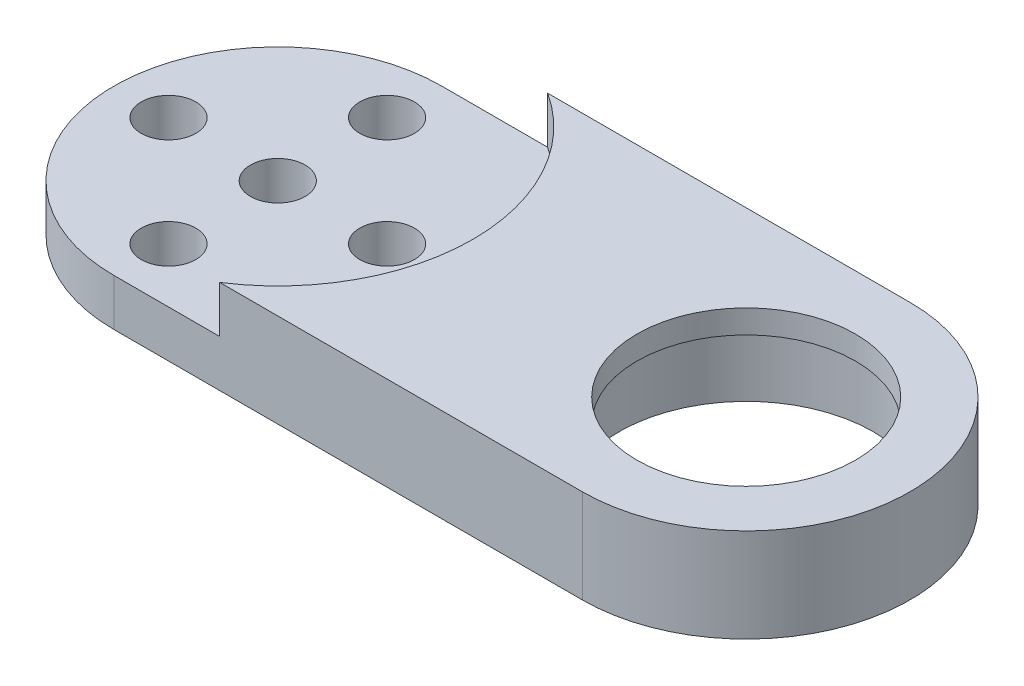
from build123d import *

# Parameters (mm, degrees)
BOSS_EXTRUDE1_DEPTH     = 6
SKETCH4_R               = 1.75
SERVO_HORN_HOLES_DEPTH  = 29.222331583
SKETCH5_R               = 8.15
BEARING_PRESS_FIT_DEPTH = 4.5
SKETCH7_R               = 12.5
CUT_EXTRUDE1_DEPTH      = 3
SKETCH8_R               = 7
CUT_EXTRUDE2_DEPTH      = 28.941904015


with BuildPart() as part:
    # Sketch2 → Boss-Extrude1 (new body)
    with BuildSketch(Plane(origin=(0, 0, 0), x_dir=(1, 0, 0), z_dir=(0, 1, 0))):
        with BuildLine():
            Line((15, 10.5), (-15, 10.5))
            ThreePointArc((-15, 10.5), (-25.5, 0), (-15, -10.5))
            Line((-15, -10.5), (15, -10.5))
            ThreePointArc((15, -10.5), (25.5, 0), (15, 10.5))
        make_face()
    extrude(amount=BOSS_EXTRUDE1_DEPTH)

    # Sketch4 → Servo horn holes (cut, through all)
    with BuildSketch(Plane(origin=(0, 6, 0), x_dir=(1, 0, 0), z_dir=(0, 1, 0))):
        with Locations((-15, 0)):
            Circle(SKETCH4_R)
        with Locations((-8, 0)):
            Circle(SKETCH4_R)
        with Locations((-15, -7)):
            Circle(SKETCH4_R)
        with Locations((-22, 0)):
            Circle(SKETCH4_R)
        with Locations((-15, 7)):
            Circle(SKETCH4_R)
    extrude(amount=-SERVO_HORN_HOLES_DEPTH, mode=Mode.SUBTRACT)

    # Sketch5 → Bearing press fit (cut)
    with BuildSketch(Plane(origin=(0, 0, 0), x_dir=(-1, 0, 0), z_dir=(0, -1, 0))):
        with Locations((-15, 0)):
            Circle(SKETCH5_R)
    extrude(amount=-BEARING_PRESS_FIT_DEPTH, mode=Mode.SUBTRACT)

    # Sketch7 → Cut-Extrude1 (cut)
    with BuildSketch(Plane(origin=(0, 6, 0), x_dir=(1, 0, 0), z_dir=(0, 1, 0))):
        with Locations((-15, 0)):
            Circle(SKETCH7_R)
    extrude(amount=-CUT_EXTRUDE1_DEPTH, mode=Mode.SUBTRACT)

    # Sketch8 → Cut-Extrude2 (cut, through all)
    with BuildSketch(Plane.XZ.offset(-4.5)):
        with Locations((15, 0)):
            Circle(SKETCH8_R)
    extrude(amount=-CUT_EXTRUDE2_DEPTH, mode=Mode.SUBTRACT)


solid = part.part
